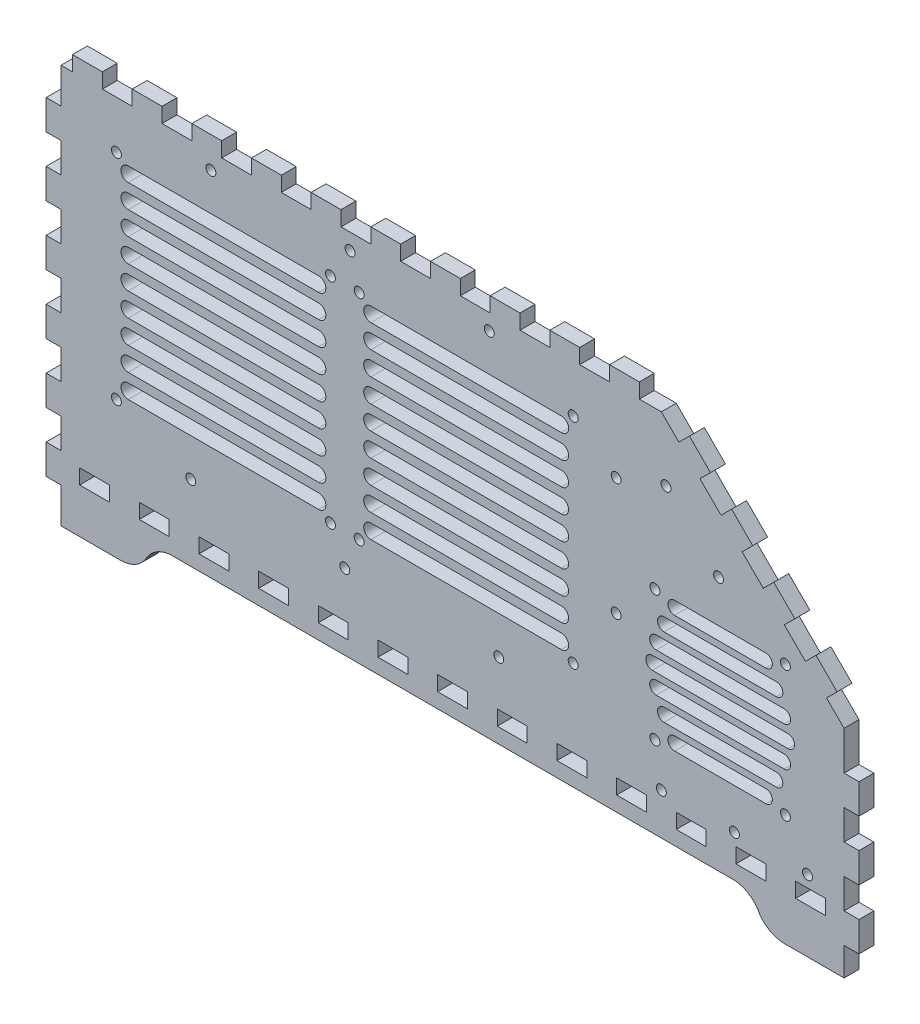
from build123d import *

# Parameters (mm, degrees)
BOSS_EXTRUDE1_DEPTH   = 5.715
CUT_EXTRUDE1_DEPTH    = 370.493090076
F_6_CLEARANCE_HOLE2_D = 3.7973
CUT_EXTRUDE2_DEPTH    = 10
F_6_CLEARANCE_HOLE1_D = 3.7973
F_6_CLEARANCE_HOLE3_D = 3.7973


with BuildPart() as part:
    # Model → Boss-Extrude1 (new body)
    with BuildSketch(Plane.XY):
        Polygon((16.1148, 22.8575), (38.9749, 22.8575), (39.3485, 22.8575), (40.4689, 22.9567), (41.9322, 23.2475), (43.3447, 23.7271), (44.366, 24.2025), (44.6899, 24.3885), (44.8511, 24.4822), (45.3263, 24.7854), (45.9341, 25.2222), (46.5116, 25.6963), (47.056, 26.2062), (47.5657, 26.7505), (48.0399, 27.3279), (48.4766, 27.9356), (48.7796, 28.411), (48.8735, 28.5722), (48.9673, 28.7348), (49.2689, 29.2103), (49.7057, 29.818), (50.1798, 30.3954), (50.6899, 30.9397), (51.2339, 31.4496), (51.8114, 31.9236), (52.4192, 32.3605), (52.8948, 32.6622), (53.0571, 32.756), (53.3799, 32.9434), (54.4008, 33.4188), (55.8133, 33.8983), (57.2766, 34.1891), (58.3971, 34.287), (58.7721, 34.287), (273.458, 34.287), (273.831, 34.287), (274.952, 34.1891), (276.415, 33.8983), (277.828, 33.4188), (278.849, 32.9434), (279.172, 32.756), (279.334, 32.6636), (279.809, 32.3605), (280.417, 31.9236), (280.995, 31.4496), (281.539, 30.9397), (282.049, 30.3954), (282.523, 29.818), (282.96, 29.2103), (283.263, 28.7348), (283.356, 28.5722), (283.449, 28.411), (283.752, 27.9356), (284.189, 27.3279), (284.663, 26.7505), (285.172, 26.2062), (285.717, 25.6963), (286.294, 25.2222), (286.902, 24.7854), (287.377, 24.4822), (287.54, 24.3885), (287.862, 24.2025), (288.884, 23.7271), (290.296, 23.2475), (291.76, 22.9567), (292.88, 22.8575), (293.255, 22.8575), (316.115, 22.8575), (316.115, 33.6917), (321.83, 33.6917), (321.83, 45.1224), (316.115, 45.1224), (316.115, 56.552), (321.83, 56.552), (321.83, 67.9813), (316.115, 67.9813), (316.115, 79.412), (321.83, 79.412), (321.83, 90.8417), (316.115, 90.8417), (316.115, 101.677), (316.115, 105.718), (309.403, 112.43), (313.444, 116.47), (305.362, 124.553), (301.321, 120.512), (293.238, 128.595), (297.28, 132.635), (289.198, 140.717), (285.156, 136.677), (277.074, 144.759), (281.114, 148.801), (273.032, 156.881), (268.992, 152.841), (260.91, 160.923), (264.951, 164.963), (256.869, 173.046), (252.827, 169.005), (246.115, 175.718), (242.074, 175.718), (237.68, 175.718), (237.68, 181.433), (226.249, 181.433), (226.249, 175.718), (214.82, 175.718), (214.82, 181.433), (203.389, 181.433), (203.389, 175.718), (191.959, 175.718), (191.959, 181.433), (180.53, 181.433), (180.53, 175.718), (169.099, 175.718), (169.099, 181.433), (157.67, 181.433), (157.67, 175.718), (146.239, 175.718), (146.239, 181.433), (134.809, 181.433), (134.809, 175.718), (123.38, 175.718), (123.38, 181.433), (111.949, 181.433), (111.949, 175.718), (100.52, 175.718), (100.52, 181.433), (89.0887, 181.433), (89.0887, 175.718), (77.6594, 175.718), (77.6594, 181.433), (66.2298, 181.433), (66.2298, 175.718), (54.7991, 175.718), (54.7991, 181.433), (43.3698, 181.433), (43.3698, 175.718), (31.9388, 175.718), (31.9388, 181.433), (20.5093, 181.433), (20.5093, 175.718), (16.1148, 175.718), (16.1148, 162.153), (10.4001, 162.153), (10.4001, 150.723), (16.1148, 150.723), (16.1148, 139.292), (10.4001, 139.292), (10.4001, 127.863), (16.1148, 127.863), (16.1148, 116.433), (10.4001, 116.433), (10.4001, 105.003), (16.1148, 105.003), (16.1148, 93.5729), (10.4001, 93.5729), (10.4001, 82.1422), (16.1148, 82.1422), (16.1148, 70.7125), (10.4001, 70.7125), (10.4001, 59.2832), (16.1148, 59.2832), (16.1148, 47.8525), (10.4001, 47.8525), (10.4001, 36.4229), (16.1148, 36.4229), align=None)
        Polygon((28.9553, 40.0032), (23.2406, 40.0032), (23.2406, 45.7179), (34.67, 45.7179), (34.67, 40.0032), align=None, mode=Mode.SUBTRACT)
        Polygon((51.8156, 40.0032), (46.0996, 40.0032), (46.0996, 45.7179), (57.5303, 45.7179), (57.5303, 40.0032), align=None, mode=Mode.SUBTRACT)
        Polygon((74.6746, 40.0032), (68.9599, 40.0032), (68.9599, 45.7179), (80.3906, 45.7179), (80.3906, 40.0032), align=None, mode=Mode.SUBTRACT)
        Polygon((97.5349, 40.0032), (91.8199, 40.0032), (91.8199, 45.7179), (103.25, 45.7179), (103.25, 40.0032), align=None, mode=Mode.SUBTRACT)
        Polygon((120.395, 40.0032), (114.68, 40.0032), (114.68, 45.7179), (126.11, 45.7179), (126.11, 40.0032), align=None, mode=Mode.SUBTRACT)
        Polygon((143.255, 40.0032), (137.541, 40.0032), (137.541, 45.7179), (148.97, 45.7179), (148.97, 40.0032), align=None, mode=Mode.SUBTRACT)
        Polygon((166.116, 40.0032), (160.4, 40.0032), (160.4, 45.7179), (171.83, 45.7179), (171.83, 40.0032), align=None, mode=Mode.SUBTRACT)
        Polygon((188.975, 40.0032), (183.26, 40.0032), (183.26, 45.7179), (194.691, 45.7179), (194.691, 40.0032), align=None, mode=Mode.SUBTRACT)
        Polygon((211.835, 40.0032), (206.12, 40.0032), (206.12, 45.7179), (217.55, 45.7179), (217.55, 40.0032), align=None, mode=Mode.SUBTRACT)
        Polygon((234.695, 40.0032), (228.98, 40.0032), (228.98, 45.7179), (240.41, 45.7179), (240.41, 40.0032), align=None, mode=Mode.SUBTRACT)
        Polygon((257.555, 40.0032), (251.841, 40.0032), (251.841, 45.7179), (263.27, 45.7179), (263.27, 40.0032), align=None, mode=Mode.SUBTRACT)
        Polygon((280.416, 40.0032), (274.7, 40.0032), (274.7, 45.7179), (286.13, 45.7179), (286.13, 40.0032), align=None, mode=Mode.SUBTRACT)
        Polygon((303.275, 40.0032), (297.56, 40.0032), (297.56, 45.7179), (308.991, 45.7179), (308.991, 40.0032), align=None, mode=Mode.SUBTRACT)
    extrude(amount=BOSS_EXTRUDE1_DEPTH)

    # Sketch1 → Cut-Extrude1 (cut, through all)
    with BuildSketch(Plane(origin=(0, 0, 0), x_dir=(-1, 0, 0), z_dir=(0, 0, -1))):
        with BuildLine():
            Line((-286.1476, 115.7127), (-251.1476, 115.7127))
            ThreePointArc((-251.1476, 115.7127), (-248.6476, 113.2127), (-251.1476, 110.7127))
            Line((-251.1476, 110.7127), (-286.1476, 110.7127))
            ThreePointArc((-286.1476, 110.7127), (-288.6476, 113.2127), (-286.1476, 115.7127))
        make_face()
        with BuildLine():
            Line((-290.1476, 103.2127), (-247.1476, 103.2127))
            ThreePointArc((-247.1476, 103.2127), (-244.6476, 105.7127), (-247.1476, 108.2127))
            Line((-247.1476, 108.2127), (-290.1476, 108.2127))
            ThreePointArc((-290.1476, 108.2127), (-292.6476, 105.7127), (-290.1476, 103.2127))
        make_face()
        with BuildLine():
            Line((-293.1476, 95.7127), (-244.1476, 95.7127))
            ThreePointArc((-244.1476, 95.7127), (-241.6476, 98.2127), (-244.1476, 100.7127))
            Line((-244.1476, 100.7127), (-293.1476, 100.7127))
            ThreePointArc((-293.1476, 100.7127), (-295.6476, 98.2127), (-293.1476, 95.7127))
        make_face()
        with BuildLine():
            Line((-294.6476, 88.2127), (-242.6476, 88.2127))
            ThreePointArc((-242.6476, 88.2127), (-240.1476, 90.7127), (-242.6476, 93.2127))
            Line((-242.6476, 93.2127), (-294.6476, 93.2127))
            ThreePointArc((-294.6476, 93.2127), (-297.1476, 90.7127), (-294.6476, 88.2127))
        make_face()
        with BuildLine():
            Line((-293.1476, 80.7127), (-244.1476, 80.7127))
            ThreePointArc((-244.1476, 80.7127), (-241.6476, 83.2127), (-244.1476, 85.7127))
            Line((-244.1476, 85.7127), (-293.1476, 85.7127))
            ThreePointArc((-293.1476, 85.7127), (-295.6476, 83.2127), (-293.1476, 80.7127))
        make_face()
        with BuildLine():
            Line((-290.1476, 73.2127), (-247.1476, 73.2127))
            ThreePointArc((-247.1476, 73.2127), (-244.6476, 75.7127), (-247.1476, 78.2127))
            Line((-247.1476, 78.2127), (-290.1476, 78.2127))
            ThreePointArc((-290.1476, 78.2127), (-292.6476, 75.7127), (-290.1476, 73.2127))
        make_face()
        with BuildLine():
            Line((-286.1476, 65.7127), (-251.1476, 65.7127))
            ThreePointArc((-251.1476, 65.7127), (-248.6476, 68.2127), (-251.1476, 70.7127))
            Line((-251.1476, 70.7127), (-286.1476, 70.7127))
            ThreePointArc((-286.1476, 70.7127), (-288.6476, 68.2127), (-286.1476, 65.7127))
        make_face()
    extrude(amount=-CUT_EXTRUDE1_DEPTH, mode=Mode.SUBTRACT)

    # #6 Clearance Hole2 (through all)
    with Locations(Plane(origin=(0, 0, 0), x_dir=(-1, 0, 0), z_dir=(0, 0, -1))):
        with Locations((-293.6476, 115.7127), (-243.6476, 115.7127), (-293.6476, 65.7127), (-243.6476, 65.7127)):
            Hole(F_6_CLEARANCE_HOLE2_D / 2)

    # Sketch4 → Cut-Extrude2 (cut)
    with BuildSketch(Plane(origin=(0, 0, 0), x_dir=(-1, 0, 0), z_dir=(0, 0, -1))):
        with BuildLine():
            Line((-207.83135, 155.1825), (-134.83135, 155.1825))
            ThreePointArc((-134.83135, 155.1825), (-132.08135, 152.4325), (-134.83135, 149.6825))
            Line((-134.83135, 149.6825), (-207.83135, 149.6825))
            ThreePointArc((-207.83135, 149.6825), (-210.58135, 152.4325), (-207.83135, 155.1825))
        make_face()
        with BuildLine():
            Line((-207.83135, 140.6825), (-134.83135, 140.6825))
            ThreePointArc((-134.83135, 140.6825), (-132.08135, 143.4325), (-134.83135, 146.1825))
            Line((-134.83135, 146.1825), (-207.83135, 146.1825))
            ThreePointArc((-207.83135, 146.1825), (-210.58135, 143.4325), (-207.83135, 140.6825))
        make_face()
        with BuildLine():
            Line((-207.83135, 131.6825), (-134.83135, 131.6825))
            ThreePointArc((-134.83135, 131.6825), (-132.08135, 134.4325), (-134.83135, 137.1825))
            Line((-134.83135, 137.1825), (-207.83135, 137.1825))
            ThreePointArc((-207.83135, 137.1825), (-210.58135, 134.4325), (-207.83135, 131.6825))
        make_face()
        with BuildLine():
            Line((-207.83135, 122.6825), (-134.83135, 122.6825))
            ThreePointArc((-134.83135, 122.6825), (-132.08135, 125.4325), (-134.83135, 128.1825))
            Line((-134.83135, 128.1825), (-207.83135, 128.1825))
            ThreePointArc((-207.83135, 128.1825), (-210.58135, 125.4325), (-207.83135, 122.6825))
        make_face()
        with BuildLine():
            Line((-207.83135, 113.6825), (-134.83135, 113.6825))
            ThreePointArc((-134.83135, 113.6825), (-132.08135, 116.4325), (-134.83135, 119.1825))
            Line((-134.83135, 119.1825), (-207.83135, 119.1825))
            ThreePointArc((-207.83135, 119.1825), (-210.58135, 116.4325), (-207.83135, 113.6825))
        make_face()
        with BuildLine():
            Line((-207.83135, 104.6825), (-134.83135, 104.6825))
            ThreePointArc((-134.83135, 104.6825), (-132.08135, 107.4325), (-134.83135, 110.1825))
            Line((-134.83135, 110.1825), (-207.83135, 110.1825))
            ThreePointArc((-207.83135, 110.1825), (-210.58135, 107.4325), (-207.83135, 104.6825))
        make_face()
        with BuildLine():
            Line((-207.83135, 95.6825), (-134.83135, 95.6825))
            ThreePointArc((-134.83135, 95.6825), (-132.08135, 98.4325), (-134.83135, 101.1825))
            Line((-134.83135, 101.1825), (-207.83135, 101.1825))
            ThreePointArc((-207.83135, 101.1825), (-210.58135, 98.4325), (-207.83135, 95.6825))
        make_face()
        with BuildLine():
            Line((-207.83135, 86.6825), (-134.83135, 86.6825))
            ThreePointArc((-134.83135, 86.6825), (-132.08135, 89.4325), (-134.83135, 92.1825))
            Line((-134.83135, 92.1825), (-207.83135, 92.1825))
            ThreePointArc((-207.83135, 92.1825), (-210.58135, 89.4325), (-207.83135, 86.6825))
        make_face()
        with BuildLine():
            Line((-207.83135, 77.6825), (-134.83135, 77.6825))
            ThreePointArc((-134.83135, 77.6825), (-132.08135, 80.4325), (-134.83135, 83.1825))
            Line((-134.83135, 83.1825), (-207.83135, 83.1825))
            ThreePointArc((-207.83135, 83.1825), (-210.58135, 80.4325), (-207.83135, 77.6825))
        make_face()
        with BuildLine():
            Line((-41.83135, 83.1825), (-114.83135, 83.1825))
            ThreePointArc((-114.83135, 83.1825), (-117.58135, 80.4325), (-114.83135, 77.6825))
            Line((-114.83135, 77.6825), (-41.83135, 77.6825))
            ThreePointArc((-41.83135, 77.6825), (-39.08135, 80.4325), (-41.83135, 83.1825))
        make_face()
        with BuildLine():
            Line((-41.83135, 92.1825), (-114.83135, 92.1825))
            ThreePointArc((-114.83135, 92.1825), (-117.58135, 89.4325), (-114.83135, 86.6825))
            Line((-114.83135, 86.6825), (-41.83135, 86.6825))
            ThreePointArc((-41.83135, 86.6825), (-39.08135, 89.4325), (-41.83135, 92.1825))
        make_face()
        with BuildLine():
            Line((-41.83135, 101.1825), (-114.83135, 101.1825))
            ThreePointArc((-114.83135, 101.1825), (-117.58135, 98.4325), (-114.83135, 95.6825))
            Line((-114.83135, 95.6825), (-41.83135, 95.6825))
            ThreePointArc((-41.83135, 95.6825), (-39.08135, 98.4325), (-41.83135, 101.1825))
        make_face()
        with BuildLine():
            Line((-41.83135, 110.1825), (-114.83135, 110.1825))
            ThreePointArc((-114.83135, 110.1825), (-117.58135, 107.4325), (-114.83135, 104.6825))
            Line((-114.83135, 104.6825), (-41.83135, 104.6825))
            ThreePointArc((-41.83135, 104.6825), (-39.08135, 107.4325), (-41.83135, 110.1825))
        make_face()
        with BuildLine():
            Line((-41.83135, 119.1825), (-114.83135, 119.1825))
            ThreePointArc((-114.83135, 119.1825), (-117.58135, 116.4325), (-114.83135, 113.6825))
            Line((-114.83135, 113.6825), (-41.83135, 113.6825))
            ThreePointArc((-41.83135, 113.6825), (-39.08135, 116.4325), (-41.83135, 119.1825))
        make_face()
        with BuildLine():
            Line((-41.83135, 128.1825), (-114.83135, 128.1825))
            ThreePointArc((-114.83135, 128.1825), (-117.58135, 125.4325), (-114.83135, 122.6825))
            Line((-114.83135, 122.6825), (-41.83135, 122.6825))
            ThreePointArc((-41.83135, 122.6825), (-39.08135, 125.4325), (-41.83135, 128.1825))
        make_face()
        with BuildLine():
            Line((-41.83135, 137.1825), (-114.83135, 137.1825))
            ThreePointArc((-114.83135, 137.1825), (-117.58135, 134.4325), (-114.83135, 131.6825))
            Line((-114.83135, 131.6825), (-41.83135, 131.6825))
            ThreePointArc((-41.83135, 131.6825), (-39.08135, 134.4325), (-41.83135, 137.1825))
        make_face()
        with BuildLine():
            Line((-41.83135, 146.1825), (-114.83135, 146.1825))
            ThreePointArc((-114.83135, 146.1825), (-117.58135, 143.4325), (-114.83135, 140.6825))
            Line((-114.83135, 140.6825), (-41.83135, 140.6825))
            ThreePointArc((-41.83135, 140.6825), (-39.08135, 143.4325), (-41.83135, 146.1825))
        make_face()
        with BuildLine():
            Line((-41.83135, 155.1825), (-114.83135, 155.1825))
            ThreePointArc((-114.83135, 155.1825), (-117.58135, 152.4325), (-114.83135, 149.6825))
            Line((-114.83135, 149.6825), (-41.83135, 149.6825))
            ThreePointArc((-41.83135, 149.6825), (-39.08135, 152.4325), (-41.83135, 155.1825))
        make_face()
    extrude(amount=-CUT_EXTRUDE2_DEPTH, mode=Mode.SUBTRACT)

    # #6 Clearance Hole1 (through all)
    with Locations(Plane(origin=(0, 0, 0), x_dir=(-1, 0, 0), z_dir=(0, 0, -1))):
        with Locations((-212.33135, 157.4325), (-130.33135, 157.4325), (-119.33135, 157.4325), (-37.33135, 157.4325), (-37.33135, 75.4325), (-119.33135, 75.4325), (-130.33135, 75.4325), (-212.33135, 75.4325)):
            Hole(F_6_CLEARANCE_HOLE1_D / 2)

    # #6 Clearance Hole3 (through all)
    with Locations(Plane.XY.offset(5.715)):
        with Locations((73.531766667, 169.575), (126.8651, 169.575), (180.198433333, 169.575), (65.83135, 63.2127), (183.83135, 63.2127), (124.83135, 63.2127), (228.7976, 145.2151), (228.7976, 100.2151), (246.1141, 50.2127), (274.1141, 50.2127), (302.1141, 50.2127), (268.047987771, 131.855302012), (247.895444507, 152.007845276)):
            Hole(F_6_CLEARANCE_HOLE3_D / 2)


solid = part.part
